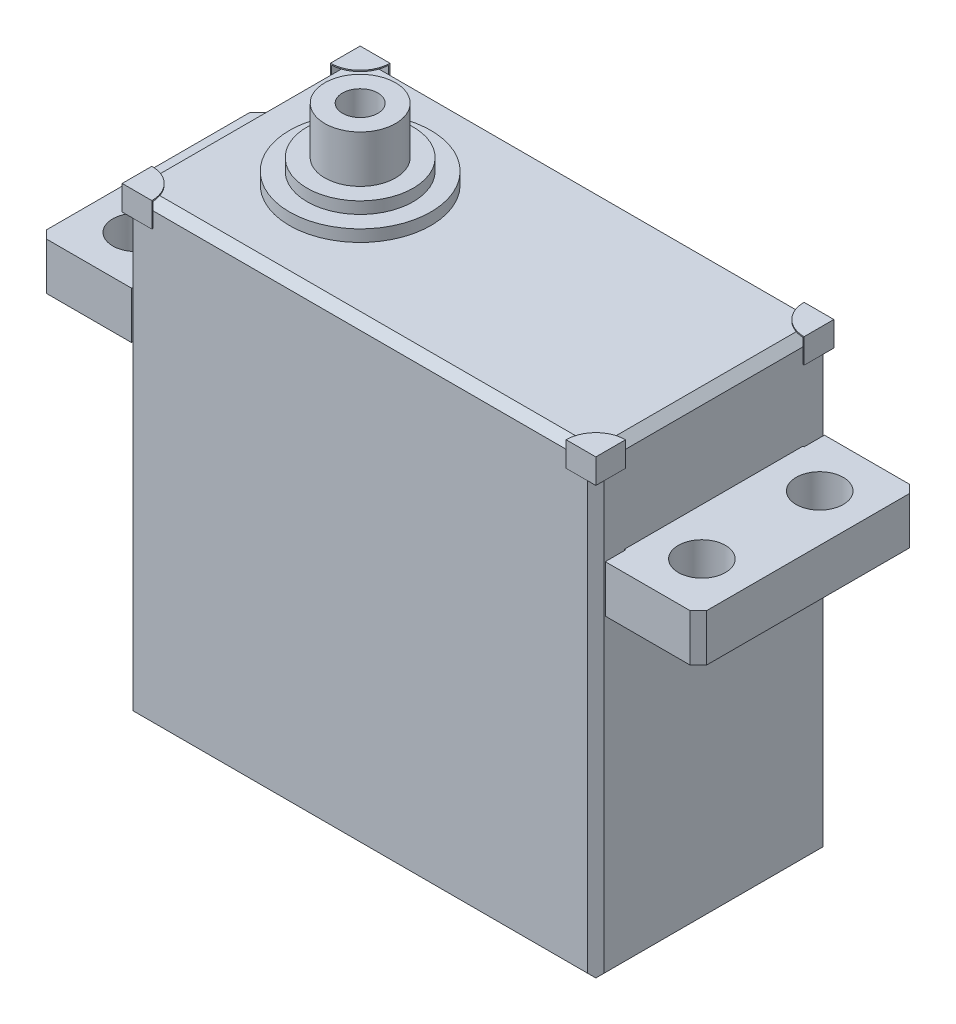
from build123d import *

# Parameters (mm, degrees)
SKETCH_1_W                   = 40
SKETCH_1_H                   = 20
EXTRUDE_1_DEPTH              = 39
EXTRUDE_START                = 31
SKETCH_1_6_R                 = 2
EXTRUDE_2_DEPTH              = 4
EXTRUDE_START_2              = 39
SKETCH_1_9_R                 = 3
EXTRUDE_3_DEPTH              = 6
SKETCH_1_10_R                = 6
EXTRUDE_4_DEPTH              = 1
EXTRUDE_START_3              = 40
SKETCH_1_13_R                = 4.5
EXTRUDE_5_DEPTH              = 1
CUT_EXTRUDE_START            = 45
SKETCH_1_16_R                = 1.5
CUT_EXTRUDE_1_DEPTH          = 4
SPLIT_BODIES_1_OUTLINE_W     = 40
SPLIT_BODIES_1_OUTLINE_H     = 20
SPLIT_BODIES_1_DEPTH         = 39
SPLIT_START                  = 39
SPLIT_BODIES_1_2_OUTLINE_R   = 4.5
SPLIT_BODIES_1_2_DEPTH       = 2
SPLIT_START_2                = 41
SPLIT_BODIES_1_3_OUTLINE_R   = 3
SPLIT_BODIES_1_3_OUTLINE_R_2 = 1.5
SPLIT_BODIES_1_3_DEPTH       = 4
SPLIT_BODIES_1_4_OUTLINE_R   = 6
SPLIT_BODIES_1_4_OUTLINE_R_2 = 4.5
SPLIT_BODIES_1_4_DEPTH       = 1
SPLIT_BODIES_1_5_OUTLINE_W   = 46
SPLIT_BODIES_1_5_OUTLINE_H   = 22
SPLIT_BODIES_1_5_DEPTH       = 48
SPLIT_START_3                = 27
SPLIT_BODIES_1_6_OUTLINE_R   = 2
SPLIT_BODIES_1_6_DEPTH       = 4
CHAMFER_9_SIZE               = 0.7
CHAMFER_10_SIZE              = 0.7
CHAMFER_11_SIZE              = 0.7
CHAMFER_12_SIZE              = 0.7
EXTRUDE_START_4              = 39.1
EXTRUDE_6_DEPTH              = 0.1
EXTRUDE_7_DEPTH              = 2


# Read off the part's stored shape, not the designer's step: 分割1
with BuildPart() as part:
    # 草图1 → 凸台-拉伸1 (new body)
    with BuildSketch(Plane(origin=(0, 0, 0), x_dir=(1, 0, 0), z_dir=(0, 1, 0))):
        with Locations((20, 10)):
            Rectangle(SKETCH_1_W, SKETCH_1_H)
    extrude(amount=EXTRUDE_1_DEPTH)

    # 草图1<6> → 凸台-拉伸2 (add)
    # profile 1 of 2: a face of its own
    with BuildSketch(Plane(origin=(0, 0, 0), x_dir=(1, 0, 0), z_dir=(0, 1, 0)).offset(EXTRUDE_START)):
        with BuildLine():
            ThreePointArc((-0.1, 2.424701022), (-0.049990188, 2.424205671), (0, 2.422719812))
            Line((0, 2.422719812), (0, 17.577280188))
            ThreePointArc((0, 17.577280188), (-0.049990188, 17.575794329), (-0.1, 17.575298978))
            Line((-0.1, 17.575298978), (-0.1, 19.3))
            Line((-0.1, 19.3), (-8, 19.3))
            Line((-8, 19.3), (-8, 0.7))
            Line((-8, 0.7), (-0.1, 0.7))
            Line((-0.1, 0.7), (-0.1, 2.424701022))
        make_face()
        with Locations(Location((-4, 5, 0), (0, 0, 270))):
            Circle(SKETCH_1_6_R, mode=Mode.SUBTRACT)
        with Locations(Location((-4, 15, 0), (0, 0, 270))):
            Circle(SKETCH_1_6_R, mode=Mode.SUBTRACT)
    # profile 2 of 2: a face of its own
    with BuildSketch(Plane(origin=(0, 0, 0), x_dir=(1, 0, 0), z_dir=(0, 1, 0)).offset(EXTRUDE_START)):
        with BuildLine():
            Line((40, 17.577280188), (40, 2.422719812))
            ThreePointArc((40, 2.422719812), (40.049990188, 2.424205671), (40.1, 2.424701022))
            Line((40.1, 2.424701022), (40.1, 0.7))
            Line((40.1, 0.7), (48, 0.7))
            Line((48, 0.7), (48, 19.3))
            Line((48, 19.3), (40.1, 19.3))
            Line((40.1, 19.3), (40.1, 17.575298978))
            ThreePointArc((40.1, 17.575298978), (40.049990188, 17.575794329), (40, 17.577280188))
        make_face()
        with Locations(Location((44, 5, 0), (0, 0, 270))):
            Circle(SKETCH_1_6_R, mode=Mode.SUBTRACT)
        with Locations(Location((44, 15, 0), (0, 0, 270))):
            Circle(SKETCH_1_6_R, mode=Mode.SUBTRACT)
    extrude(amount=-EXTRUDE_2_DEPTH)

    # 草图1<9> → 凸台-拉伸3 (add)
    with BuildSketch(Plane(origin=(0, 0, 0), x_dir=(1, 0, 0), z_dir=(0, 1, 0)).offset(EXTRUDE_START_2)):
        with Locations(Location((10, 10, 0), (0, 0, 270))):
            Circle(SKETCH_1_9_R)
    extrude(amount=EXTRUDE_3_DEPTH)

    # 草图1<10> → 凸台-拉伸4 (add)
    with BuildSketch(Plane(origin=(0, 0, 0), x_dir=(1, 0, 0), z_dir=(0, 1, 0)).offset(EXTRUDE_START_2)):
        with Locations(Location((10, 10, 0), (0, 0, 270))):
            Circle(SKETCH_1_10_R)
    extrude(amount=EXTRUDE_4_DEPTH)

    # 草图1<13> → 凸台-拉伸5 (add)
    with BuildSketch(Plane(origin=(0, 0, 0), x_dir=(1, 0, 0), z_dir=(0, 1, 0)).offset(EXTRUDE_START_3)):
        with Locations(Location((10, 10, 0), (0, 0, 270))):
            Circle(SKETCH_1_13_R)
    extrude(amount=EXTRUDE_5_DEPTH)

    # 草图1<16> → 切除-拉伸1 (cut)
    with BuildSketch(Plane(origin=(0, 0, 0), x_dir=(1, 0, 0), z_dir=(0, 1, 0)).offset(CUT_EXTRUDE_START)):
        with Locations(Location((10, 10, 0), (0, 0, 270))):
            Circle(SKETCH_1_16_R)
    extrude(amount=-CUT_EXTRUDE_1_DEPTH, mode=Mode.SUBTRACT)

    # Split Bodies 1 5 outline → Split Bodies 1 5 (cut)
    with BuildSketch(Plane.YZ):
        with Locations((22, -10)):
            Rectangle(SPLIT_BODIES_1_5_OUTLINE_W, SPLIT_BODIES_1_5_OUTLINE_H)
    extrude(amount=SPLIT_BODIES_1_5_DEPTH, mode=Mode.SUBTRACT)

    # 倒角10
    chamfer_10_edges = [part.edges().sort_by_distance(p)[0] for p in [
        (-8, 29, -19.3),
        (-8, 29, -0.7),
    ]]
    chamfer(chamfer_10_edges, length=CHAMFER_10_SIZE)


with BuildPart() as body_2:
    # Split Bodies 1 outline → Split Bodies 1 (new body)
    with BuildSketch(Plane(origin=(0, 0, 0), x_dir=(1, 0, 0), z_dir=(0, 1, 0))):
        with Locations((20, 10)):
            Rectangle(SPLIT_BODIES_1_OUTLINE_W, SPLIT_BODIES_1_OUTLINE_H)
    extrude(amount=SPLIT_BODIES_1_DEPTH)

    # Split Bodies 1 2 outline → Split Bodies 1 2 (add)
    with BuildSketch(Plane(origin=(0, 0, 0), x_dir=(1, 0, 0), z_dir=(0, 1, 0)).offset(SPLIT_START)):
        with Locations((10, 10)):
            Circle(SPLIT_BODIES_1_2_OUTLINE_R)
    extrude(amount=SPLIT_BODIES_1_2_DEPTH)

    # Split Bodies 1 3 outline → Split Bodies 1 3 (add)
    with BuildSketch(Plane(origin=(0, 0, 0), x_dir=(1, 0, 0), z_dir=(0, 1, 0)).offset(SPLIT_START_2)):
        with Locations((10, 10)):
            Circle(SPLIT_BODIES_1_3_OUTLINE_R)
        with Locations((10, 10)):
            Circle(SPLIT_BODIES_1_3_OUTLINE_R_2, mode=Mode.SUBTRACT)
    extrude(amount=SPLIT_BODIES_1_3_DEPTH)

    # Split Bodies 1 4 outline → Split Bodies 1 4 (add)
    with BuildSketch(Plane(origin=(0, 0, 0), x_dir=(1, 0, 0), z_dir=(0, 1, 0)).offset(SPLIT_START)):
        with Locations((10, 10)):
            Circle(SPLIT_BODIES_1_4_OUTLINE_R)
        with Locations((10, 10)):
            Circle(SPLIT_BODIES_1_4_OUTLINE_R_2, mode=Mode.SUBTRACT)
    extrude(amount=SPLIT_BODIES_1_4_DEPTH)

    # 倒角9
    chamfer_9_edges = [body_2.edges().sort_by_distance(p)[0] for p in [
        (20, 0, 0),
        (40, 0, -10),
        (20, 0, -20),
        (0, 0, -10),
        (20, 39, 0),
        (40, 39, -10),
        (20, 39, -20),
        (0, 39, -10),
    ]]
    chamfer(chamfer_9_edges, length=CHAMFER_9_SIZE)

    # 倒角12
    chamfer_12_edges = [body_2.edges().sort_by_distance(p)[0] for p in [
        (40, 19.5, -20),
        (40, 19.5, 0),
        (0, 19.5, 0),
        (0, 19.5, -20),
    ]]
    chamfer(chamfer_12_edges, length=CHAMFER_12_SIZE)

    # 草图1<26> → 凸台-拉伸6 (add)
    with BuildSketch(Plane(origin=(0, 0, 0), x_dir=(1, 0, 0), z_dir=(0, 1, 0)).offset(EXTRUDE_START_4)):
        Polygon((0, -0.1), (0, 0), (0, 0.7), (-0.1, 0.7), (-0.1, -0.1), align=None)
        with BuildLine():
            Line((0, 0.7), (0, 0))
            Line((0, 0), (2.422719812, 0))
            ThreePointArc((2.422719812, 0), (2.349175143, 0.512908125), (2.172468976, 1))
            Line((2.172468976, 1), (1, 1))
            Line((1, 1), (1, 2.172468976))
            ThreePointArc((1, 2.172468976), (0.512908125, 2.349175143), (0, 2.422719812))
            Line((0, 2.422719812), (0, 0.7))
        make_face()
        with BuildLine():
            Line((2.422719812, 0), (0, 0))
            Line((0, 0), (0, -0.1))
            Line((0, -0.1), (2.424701022, -0.1))
            ThreePointArc((2.424701022, -0.1), (2.424205671, -0.049990188), (2.422719812, 0))
        make_face()
        with BuildLine():
            Line((-0.1, 0.7), (0, 0.7))
            Line((0, 0.7), (0, 2.422719812))
            ThreePointArc((0, 2.422719812), (-0.049990188, 2.424205671), (-0.1, 2.424701022))
            Line((-0.1, 2.424701022), (-0.1, 0.7))
        make_face()
        with BuildLine():
            ThreePointArc((37.827531024, 1), (37.650824857, 0.512908125), (37.577280188, 0))
            Line((37.577280188, 0), (40, 0))
            Line((40, 0), (40, 0.7))
            Line((40, 0.7), (40, 2.422719812))
            ThreePointArc((40, 2.422719812), (39.487091875, 2.349175143), (39, 2.172468976))
            Line((39, 2.172468976), (39, 1))
            Line((39, 1), (37.827531024, 1))
        make_face()
        with BuildLine():
            Line((40, 0), (37.577280188, 0))
            ThreePointArc((37.577280188, 0), (37.575794329, -0.049990188), (37.575298978, -0.1))
            Line((37.575298978, -0.1), (40, -0.1))
            Line((40, -0.1), (40.1, -0.1))
            Line((40.1, -0.1), (40.1, 0.7))
            Line((40.1, 0.7), (40, 0.7))
            Line((40, 0.7), (40, 0))
        make_face()
        with BuildLine():
            Line((40, 2.422719812), (40, 0.7))
            Line((40, 0.7), (40.1, 0.7))
            Line((40.1, 0.7), (40.1, 2.424701022))
            ThreePointArc((40.1, 2.424701022), (40.049990188, 2.424205671), (40, 2.422719812))
        make_face()
        with BuildLine():
            ThreePointArc((-0.1, 17.575298978), (-0.049990188, 17.575794329), (0, 17.577280188))
            Line((0, 17.577280188), (0, 19.3))
            Line((0, 19.3), (-0.1, 19.3))
            Line((-0.1, 19.3), (-0.1, 17.575298978))
        make_face()
        with BuildLine():
            Line((-0.1, 19.3), (0, 19.3))
            Line((0, 19.3), (0, 20))
            Line((0, 20), (2.422719812, 20))
            ThreePointArc((2.422719812, 20), (2.424205671, 20.049990188), (2.424701022, 20.1))
            Line((2.424701022, 20.1), (0, 20.1))
            Line((0, 20.1), (-0.1, 20.1))
            Line((-0.1, 20.1), (-0.1, 19.3))
        make_face()
        with BuildLine():
            Line((0, 19.3), (0, 17.577280188))
            ThreePointArc((0, 17.577280188), (0.512908125, 17.650824857), (1, 17.827531024))
            Line((1, 17.827531024), (1, 19))
            Line((1, 19), (2.172468976, 19))
            ThreePointArc((2.172468976, 19), (2.349175143, 19.487091875), (2.422719812, 20))
            Line((2.422719812, 20), (0, 20))
            Line((0, 20), (0, 19.3))
        make_face()
        with BuildLine():
            Line((39, 19), (39, 17.827531024))
            ThreePointArc((39, 17.827531024), (39.487091875, 17.650824857), (40, 17.577280188))
            Line((40, 17.577280188), (40, 19.3))
            Line((40, 19.3), (40, 20))
            Line((40, 20), (37.577280188, 20))
            ThreePointArc((37.577280188, 20), (37.650824857, 19.487091875), (37.827531024, 19))
            Line((37.827531024, 19), (39, 19))
        make_face()
        with BuildLine():
            Line((40, 20), (40, 19.3))
            Line((40, 19.3), (40.1, 19.3))
            Line((40.1, 19.3), (40.1, 20.1))
            Line((40.1, 20.1), (40, 20.1))
            Line((40, 20.1), (37.575298978, 20.1))
            ThreePointArc((37.575298978, 20.1), (37.575794329, 20.049990188), (37.577280188, 20))
            Line((37.577280188, 20), (40, 20))
        make_face()
        with BuildLine():
            Line((40, 19.3), (40, 17.577280188))
            ThreePointArc((40, 17.577280188), (40.049990188, 17.575794329), (40.1, 17.575298978))
            Line((40.1, 17.575298978), (40.1, 19.3))
            Line((40.1, 19.3), (40, 19.3))
        make_face()
        with BuildLine():
            Line((1, 1), (2.172468976, 1))
            ThreePointArc((2.172468976, 1), (1.685233213, 1.685233213), (1, 2.172468976))
            Line((1, 2.172468976), (1, 1))
        make_face()
        with BuildLine():
            Line((1, 19), (1, 17.827531024))
            ThreePointArc((1, 17.827531024), (1.685233213, 18.314766787), (2.172468976, 19))
            Line((2.172468976, 19), (1, 19))
        make_face()
        with BuildLine():
            ThreePointArc((37.827531024, 19), (38.314766787, 18.314766787), (39, 17.827531024))
            Line((39, 17.827531024), (39, 19))
            Line((39, 19), (37.827531024, 19))
        make_face()
        with BuildLine():
            ThreePointArc((39, 2.172468976), (38.314766787, 1.685233213), (37.827531024, 1))
            Line((37.827531024, 1), (39, 1))
            Line((39, 1), (39, 2.172468976))
        make_face()
    extrude(amount=-EXTRUDE_6_DEPTH)

    # 草图1<27> → 凸台-拉伸7 (add)
    with BuildSketch(Plane(origin=(0, 0, 0), x_dir=(1, 0, 0), z_dir=(0, 1, 0)).offset(EXTRUDE_START_2)):
        with BuildLine():
            Line((-0.1, 19.3), (0, 19.3))
            Line((0, 19.3), (0, 20))
            Line((0, 20), (2.422719812, 20))
            ThreePointArc((2.422719812, 20), (2.424205671, 20.049990188), (2.424701022, 20.1))
            Line((2.424701022, 20.1), (0, 20.1))
            Line((0, 20.1), (-0.1, 20.1))
            Line((-0.1, 20.1), (-0.1, 19.3))
        make_face()
        with BuildLine():
            ThreePointArc((-0.1, 17.575298978), (-0.049990188, 17.575794329), (0, 17.577280188))
            Line((0, 17.577280188), (0, 19.3))
            Line((0, 19.3), (-0.1, 19.3))
            Line((-0.1, 19.3), (-0.1, 17.575298978))
        make_face()
        Polygon((0, -0.1), (0, 0), (0, 0.7), (-0.1, 0.7), (-0.1, -0.1), align=None)
        with BuildLine():
            Line((-0.1, 0.7), (0, 0.7))
            Line((0, 0.7), (0, 2.422719812))
            ThreePointArc((0, 2.422719812), (-0.049990188, 2.424205671), (-0.1, 2.424701022))
            Line((-0.1, 2.424701022), (-0.1, 0.7))
        make_face()
        with BuildLine():
            Line((2.422719812, 0), (0, 0))
            Line((0, 0), (0, -0.1))
            Line((0, -0.1), (2.424701022, -0.1))
            ThreePointArc((2.424701022, -0.1), (2.424205671, -0.049990188), (2.422719812, 0))
        make_face()
        with BuildLine():
            Line((40, 0), (37.577280188, 0))
            ThreePointArc((37.577280188, 0), (37.575794329, -0.049990188), (37.575298978, -0.1))
            Line((37.575298978, -0.1), (40, -0.1))
            Line((40, -0.1), (40.1, -0.1))
            Line((40.1, -0.1), (40.1, 0.7))
            Line((40.1, 0.7), (40, 0.7))
            Line((40, 0.7), (40, 0))
        make_face()
        with BuildLine():
            Line((40, 2.422719812), (40, 0.7))
            Line((40, 0.7), (40.1, 0.7))
            Line((40.1, 0.7), (40.1, 2.424701022))
            ThreePointArc((40.1, 2.424701022), (40.049990188, 2.424205671), (40, 2.422719812))
        make_face()
        with BuildLine():
            Line((40, 19.3), (40, 17.577280188))
            ThreePointArc((40, 17.577280188), (40.049990188, 17.575794329), (40.1, 17.575298978))
            Line((40.1, 17.575298978), (40.1, 19.3))
            Line((40.1, 19.3), (40, 19.3))
        make_face()
        with BuildLine():
            Line((40, 20), (40, 19.3))
            Line((40, 19.3), (40.1, 19.3))
            Line((40.1, 19.3), (40.1, 20.1))
            Line((40.1, 20.1), (40, 20.1))
            Line((40, 20.1), (37.575298978, 20.1))
            ThreePointArc((37.575298978, 20.1), (37.575794329, 20.049990188), (37.577280188, 20))
            Line((37.577280188, 20), (40, 20))
        make_face()
    extrude(amount=-EXTRUDE_7_DEPTH)


with BuildPart() as body_3:
    # Split Bodies 1 6 outline → Split Bodies 1 6 (new body)
    with BuildSketch(Plane(origin=(0, 0, 0), x_dir=(1, 0, 0), z_dir=(0, 1, 0)).offset(SPLIT_START_3)):
        with BuildLine():
            Line((40, 17.577280188), (40, 2.422719812))
            ThreePointArc((40, 2.422719812), (40.049990188, 2.424205671), (40.1, 2.424701022))
            Line((40.1, 2.424701022), (40.1, 0.7))
            Line((40.1, 0.7), (48, 0.7))
            Line((48, 0.7), (48, 19.3))
            Line((48, 19.3), (40.1, 19.3))
            Line((40.1, 19.3), (40.1, 17.575298978))
            ThreePointArc((40.1, 17.575298978), (40.049990188, 17.575794329), (40, 17.577280188))
        make_face()
        with Locations((44, 5)):
            Circle(SPLIT_BODIES_1_6_OUTLINE_R, mode=Mode.SUBTRACT)
        with Locations((44, 15)):
            Circle(SPLIT_BODIES_1_6_OUTLINE_R, mode=Mode.SUBTRACT)
    extrude(amount=SPLIT_BODIES_1_6_DEPTH)

    # 倒角11
    chamfer_11_edges = [body_3.edges().sort_by_distance(p)[0] for p in [
        (48, 29, -19.3),
        (48, 29, -0.7),
    ]]
    chamfer(chamfer_11_edges, length=CHAMFER_11_SIZE)


solid = Compound([part.part, body_2.part, body_3.part])
